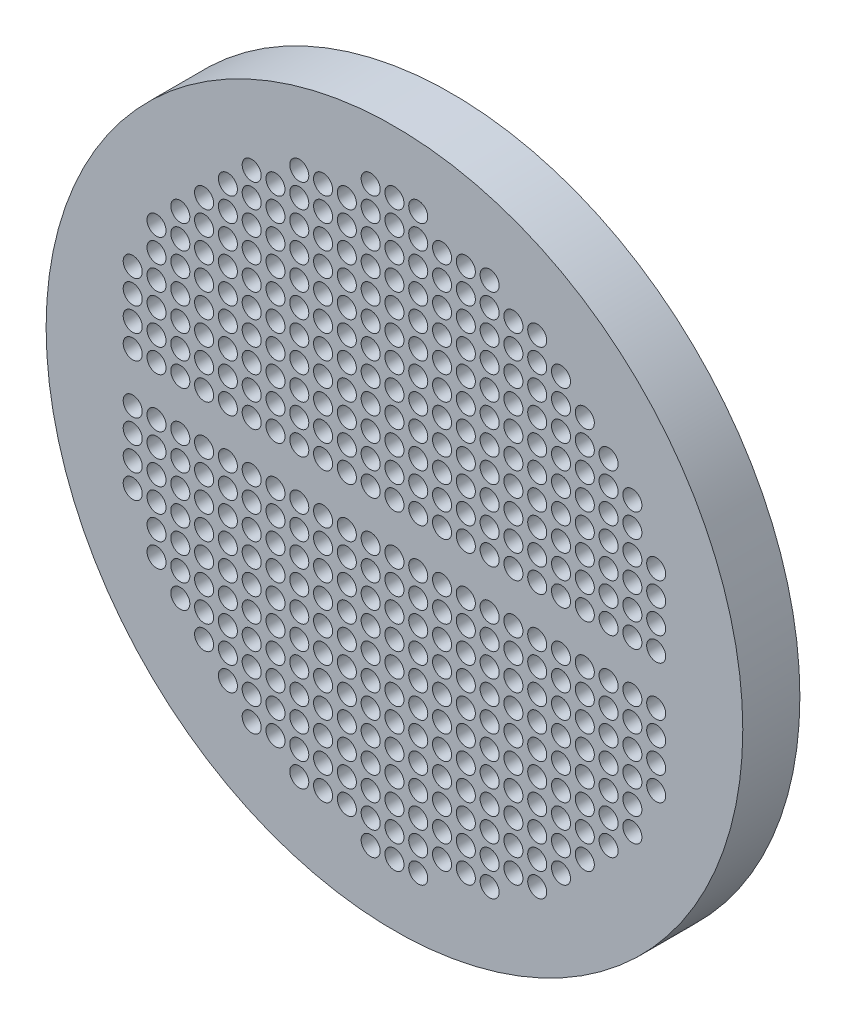
from build123d import *

# Parameters (mm, degrees)
SKETCH1_R           = 464.82
BOSS_EXTRUDE1_DEPTH = 76.2
SKETCH4_R           = 12.7
CUT_EXTRUDE1_DEPTH  = 76.2


with BuildPart() as part:
    # Sketch1 → Boss-Extrude1 (new body)
    with BuildSketch(Plane.XY):
        Circle(SKETCH1_R)
    extrude(amount=-BOSS_EXTRUDE1_DEPTH)

    # Sketch4 → Cut-Extrude1 (cut)
    with BuildSketch(Plane.XY):
        with Locations((0, 33.02)):
            Circle(SKETCH4_R)
        with Locations((-31.75, 33.02)):
            Circle(SKETCH4_R)
        with Locations((-63.5, 33.02)):
            Circle(SKETCH4_R)
        with Locations((-95.25, 33.02)):
            Circle(SKETCH4_R)
        with Locations((-127, 33.02)):
            Circle(SKETCH4_R)
        with Locations((-158.75, 33.02)):
            Circle(SKETCH4_R)
        with Locations((-190.5, 33.02)):
            Circle(SKETCH4_R)
        with Locations((-222.25, 33.02)):
            Circle(SKETCH4_R)
        with Locations((-254, 33.02)):
            Circle(SKETCH4_R)
        with Locations((-285.75, 33.02)):
            Circle(SKETCH4_R)
        with Locations((-317.5, 33.02)):
            Circle(SKETCH4_R)
        with Locations((-349.25, 33.02)):
            Circle(SKETCH4_R)
        with Locations((-31.75, 64.77)):
            Circle(SKETCH4_R)
        with Locations((-63.5, 64.77)):
            Circle(SKETCH4_R)
        with Locations((-95.25, 64.77)):
            Circle(SKETCH4_R)
        with Locations((-127, 64.77)):
            Circle(SKETCH4_R)
        with Locations((-158.75, 64.77)):
            Circle(SKETCH4_R)
        with Locations((-190.5, 64.77)):
            Circle(SKETCH4_R)
        with Locations((-222.25, 64.77)):
            Circle(SKETCH4_R)
        with Locations((-254, 64.77)):
            Circle(SKETCH4_R)
        with Locations((-285.75, 64.77)):
            Circle(SKETCH4_R)
        with Locations((-317.5, 64.77)):
            Circle(SKETCH4_R)
        with Locations((-349.25, 64.77)):
            Circle(SKETCH4_R)
        with Locations((-31.75, 96.52)):
            Circle(SKETCH4_R)
        with Locations((-63.5, 96.52)):
            Circle(SKETCH4_R)
        with Locations((-95.25, 96.52)):
            Circle(SKETCH4_R)
        with Locations((-127, 96.52)):
            Circle(SKETCH4_R)
        with Locations((-158.75, 96.52)):
            Circle(SKETCH4_R)
        with Locations((-190.5, 96.52)):
            Circle(SKETCH4_R)
        with Locations((-222.25, 96.52)):
            Circle(SKETCH4_R)
        with Locations((-254, 96.52)):
            Circle(SKETCH4_R)
        with Locations((-285.75, 96.52)):
            Circle(SKETCH4_R)
        with Locations((-317.5, 96.52)):
            Circle(SKETCH4_R)
        with Locations((-349.25, 96.52)):
            Circle(SKETCH4_R)
        with Locations((-31.75, 128.27)):
            Circle(SKETCH4_R)
        with Locations((-63.5, 128.27)):
            Circle(SKETCH4_R)
        with Locations((-95.25, 128.27)):
            Circle(SKETCH4_R)
        with Locations((-127, 128.27)):
            Circle(SKETCH4_R)
        with Locations((-158.75, 128.27)):
            Circle(SKETCH4_R)
        with Locations((-190.5, 128.27)):
            Circle(SKETCH4_R)
        with Locations((-222.25, 128.27)):
            Circle(SKETCH4_R)
        with Locations((-254, 128.27)):
            Circle(SKETCH4_R)
        with Locations((-285.75, 128.27)):
            Circle(SKETCH4_R)
        with Locations((-317.5, 128.27)):
            Circle(SKETCH4_R)
        with Locations((-349.25, 128.27)):
            Circle(SKETCH4_R)
        with Locations((-31.75, 160.02)):
            Circle(SKETCH4_R)
        with Locations((-63.5, 160.02)):
            Circle(SKETCH4_R)
        with Locations((-95.25, 160.02)):
            Circle(SKETCH4_R)
        with Locations((-127, 160.02)):
            Circle(SKETCH4_R)
        with Locations((-158.75, 160.02)):
            Circle(SKETCH4_R)
        with Locations((-190.5, 160.02)):
            Circle(SKETCH4_R)
        with Locations((-222.25, 160.02)):
            Circle(SKETCH4_R)
        with Locations((-254, 160.02)):
            Circle(SKETCH4_R)
        with Locations((-285.75, 160.02)):
            Circle(SKETCH4_R)
        with Locations((-317.5, 160.02)):
            Circle(SKETCH4_R)
        with Locations((-31.75, 191.77)):
            Circle(SKETCH4_R)
        with Locations((-63.5, 191.77)):
            Circle(SKETCH4_R)
        with Locations((-95.25, 191.77)):
            Circle(SKETCH4_R)
        with Locations((-127, 191.77)):
            Circle(SKETCH4_R)
        with Locations((-158.75, 191.77)):
            Circle(SKETCH4_R)
        with Locations((-190.5, 191.77)):
            Circle(SKETCH4_R)
        with Locations((-222.25, 191.77)):
            Circle(SKETCH4_R)
        with Locations((-254, 191.77)):
            Circle(SKETCH4_R)
        with Locations((-285.75, 191.77)):
            Circle(SKETCH4_R)
        with Locations((-317.5, 191.77)):
            Circle(SKETCH4_R)
        with Locations((-31.75, 223.52)):
            Circle(SKETCH4_R)
        with Locations((-63.5, 223.52)):
            Circle(SKETCH4_R)
        with Locations((-95.25, 223.52)):
            Circle(SKETCH4_R)
        with Locations((-127, 223.52)):
            Circle(SKETCH4_R)
        with Locations((-158.75, 223.52)):
            Circle(SKETCH4_R)
        with Locations((-190.5, 223.52)):
            Circle(SKETCH4_R)
        with Locations((-222.25, 223.52)):
            Circle(SKETCH4_R)
        with Locations((-254, 223.52)):
            Circle(SKETCH4_R)
        with Locations((-285.75, 223.52)):
            Circle(SKETCH4_R)
        with Locations((-31.75, 255.27)):
            Circle(SKETCH4_R)
        with Locations((-63.5, 255.27)):
            Circle(SKETCH4_R)
        with Locations((-95.25, 255.27)):
            Circle(SKETCH4_R)
        with Locations((-127, 255.27)):
            Circle(SKETCH4_R)
        with Locations((-158.75, 255.27)):
            Circle(SKETCH4_R)
        with Locations((-190.5, 255.27)):
            Circle(SKETCH4_R)
        with Locations((-222.25, 255.27)):
            Circle(SKETCH4_R)
        with Locations((-254, 255.27)):
            Circle(SKETCH4_R)
        with Locations((-31.75, 287.02)):
            Circle(SKETCH4_R)
        with Locations((-63.5, 287.02)):
            Circle(SKETCH4_R)
        with Locations((-95.25, 287.02)):
            Circle(SKETCH4_R)
        with Locations((-127, 287.02)):
            Circle(SKETCH4_R)
        with Locations((-158.75, 287.02)):
            Circle(SKETCH4_R)
        with Locations((-190.5, 287.02)):
            Circle(SKETCH4_R)
        with Locations((-222.25, 287.02)):
            Circle(SKETCH4_R)
        with Locations((-31.75, 318.77)):
            Circle(SKETCH4_R)
        with Locations((-63.5, 318.77)):
            Circle(SKETCH4_R)
        with Locations((-95.25, 318.77)):
            Circle(SKETCH4_R)
        with Locations((-127, 318.77)):
            Circle(SKETCH4_R)
        with Locations((-158.75, 318.77)):
            Circle(SKETCH4_R)
        with Locations((-190.5, 318.77)):
            Circle(SKETCH4_R)
        with Locations((-31.75, 350.52)):
            Circle(SKETCH4_R)
        with Locations((-63.5, 350.52)):
            Circle(SKETCH4_R)
        with Locations((-95.25, 350.52)):
            Circle(SKETCH4_R)
        with Locations((-127, 350.52)):
            Circle(SKETCH4_R)
        with Locations((-31.75, 382.27)):
            Circle(SKETCH4_R)
        with Locations((0, 64.77)):
            Circle(SKETCH4_R)
        with Locations((0, 96.52)):
            Circle(SKETCH4_R)
        with Locations((0, 128.27)):
            Circle(SKETCH4_R)
        with Locations((0, 160.02)):
            Circle(SKETCH4_R)
        with Locations((0, 191.77)):
            Circle(SKETCH4_R)
        with Locations((0, 223.52)):
            Circle(SKETCH4_R)
        with Locations((0, 255.27)):
            Circle(SKETCH4_R)
        with Locations((0, 287.02)):
            Circle(SKETCH4_R)
        with Locations((0, 318.77)):
            Circle(SKETCH4_R)
        with Locations((0, 350.52)):
            Circle(SKETCH4_R)
        with Locations((0, 382.27)):
            Circle(SKETCH4_R)
        with Locations((63.5, 350.52)):
            Circle(SKETCH4_R)
        with Locations((31.75, 350.52)):
            Circle(SKETCH4_R)
        with Locations((63.5, 318.77)):
            Circle(SKETCH4_R)
        with Locations((31.75, 318.77)):
            Circle(SKETCH4_R)
        with Locations((31.75, 287.02)):
            Circle(SKETCH4_R)
        with Locations((63.5, 255.27)):
            Circle(SKETCH4_R)
        with Locations((31.75, 255.27)):
            Circle(SKETCH4_R)
        with Locations((63.5, 223.52)):
            Circle(SKETCH4_R)
        with Locations((31.75, 223.52)):
            Circle(SKETCH4_R)
        with Locations((31.75, 191.77)):
            Circle(SKETCH4_R)
        with Locations((63.5, 160.02)):
            Circle(SKETCH4_R)
        with Locations((31.75, 160.02)):
            Circle(SKETCH4_R)
        with Locations((63.5, 128.27)):
            Circle(SKETCH4_R)
        with Locations((31.75, 128.27)):
            Circle(SKETCH4_R)
        with Locations((349.25, 96.52)):
            Circle(SKETCH4_R)
        with Locations((317.5, 96.52)):
            Circle(SKETCH4_R)
        with Locations((285.75, 96.52)):
            Circle(SKETCH4_R)
        with Locations((254, 96.52)):
            Circle(SKETCH4_R)
        with Locations((222.25, 96.52)):
            Circle(SKETCH4_R)
        with Locations((190.5, 96.52)):
            Circle(SKETCH4_R)
        with Locations((158.75, 96.52)):
            Circle(SKETCH4_R)
        with Locations((127, 96.52)):
            Circle(SKETCH4_R)
        with Locations((95.25, 96.52)):
            Circle(SKETCH4_R)
        with Locations((63.5, 96.52)):
            Circle(SKETCH4_R)
        with Locations((31.75, 96.52)):
            Circle(SKETCH4_R)
        with Locations((349.25, 64.77)):
            Circle(SKETCH4_R)
        with Locations((317.5, 64.77)):
            Circle(SKETCH4_R)
        with Locations((285.75, 64.77)):
            Circle(SKETCH4_R)
        with Locations((254, 64.77)):
            Circle(SKETCH4_R)
        with Locations((222.25, 64.77)):
            Circle(SKETCH4_R)
        with Locations((190.5, 64.77)):
            Circle(SKETCH4_R)
        with Locations((158.75, 64.77)):
            Circle(SKETCH4_R)
        with Locations((127, 64.77)):
            Circle(SKETCH4_R)
        with Locations((95.25, 64.77)):
            Circle(SKETCH4_R)
        with Locations((63.5, 64.77)):
            Circle(SKETCH4_R)
        with Locations((31.75, 64.77)):
            Circle(SKETCH4_R)
        with Locations((349.25, 33.02)):
            Circle(SKETCH4_R)
        with Locations((317.5, 33.02)):
            Circle(SKETCH4_R)
        with Locations((285.75, 33.02)):
            Circle(SKETCH4_R)
        with Locations((254, 33.02)):
            Circle(SKETCH4_R)
        with Locations((222.25, 33.02)):
            Circle(SKETCH4_R)
        with Locations((190.5, 33.02)):
            Circle(SKETCH4_R)
        with Locations((158.75, 33.02)):
            Circle(SKETCH4_R)
        with Locations((127, 33.02)):
            Circle(SKETCH4_R)
        with Locations((95.25, 33.02)):
            Circle(SKETCH4_R)
        with Locations((63.5, 33.02)):
            Circle(SKETCH4_R)
        with Locations((31.75, 33.02)):
            Circle(SKETCH4_R)
        with Locations((127, 350.52)):
            Circle(SKETCH4_R)
        with Locations((95.25, 350.52)):
            Circle(SKETCH4_R)
        with Locations((190.5, 318.77)):
            Circle(SKETCH4_R)
        with Locations((127, 318.77)):
            Circle(SKETCH4_R)
        with Locations((95.25, 318.77)):
            Circle(SKETCH4_R)
        with Locations((222.25, 287.02)):
            Circle(SKETCH4_R)
        with Locations((190.5, 287.02)):
            Circle(SKETCH4_R)
        with Locations((158.75, 287.02)):
            Circle(SKETCH4_R)
        with Locations((95.25, 287.02)):
            Circle(SKETCH4_R)
        with Locations((254, 255.27)):
            Circle(SKETCH4_R)
        with Locations((222.25, 255.27)):
            Circle(SKETCH4_R)
        with Locations((190.5, 255.27)):
            Circle(SKETCH4_R)
        with Locations((158.75, 255.27)):
            Circle(SKETCH4_R)
        with Locations((127, 255.27)):
            Circle(SKETCH4_R)
        with Locations((95.25, 255.27)):
            Circle(SKETCH4_R)
        with Locations((285.75, 223.52)):
            Circle(SKETCH4_R)
        with Locations((254, 223.52)):
            Circle(SKETCH4_R)
        with Locations((222.25, 223.52)):
            Circle(SKETCH4_R)
        with Locations((158.75, 223.52)):
            Circle(SKETCH4_R)
        with Locations((127, 223.52)):
            Circle(SKETCH4_R)
        with Locations((95.25, 223.52)):
            Circle(SKETCH4_R)
        with Locations((317.5, 191.77)):
            Circle(SKETCH4_R)
        with Locations((285.75, 191.77)):
            Circle(SKETCH4_R)
        with Locations((254, 191.77)):
            Circle(SKETCH4_R)
        with Locations((222.25, 191.77)):
            Circle(SKETCH4_R)
        with Locations((190.5, 191.77)):
            Circle(SKETCH4_R)
        with Locations((158.75, 191.77)):
            Circle(SKETCH4_R)
        with Locations((127, 191.77)):
            Circle(SKETCH4_R)
        with Locations((95.25, 191.77)):
            Circle(SKETCH4_R)
        with Locations((317.5, 160.02)):
            Circle(SKETCH4_R)
        with Locations((285.75, 160.02)):
            Circle(SKETCH4_R)
        with Locations((254, 160.02)):
            Circle(SKETCH4_R)
        with Locations((222.25, 160.02)):
            Circle(SKETCH4_R)
        with Locations((190.5, 160.02)):
            Circle(SKETCH4_R)
        with Locations((158.75, 160.02)):
            Circle(SKETCH4_R)
        with Locations((127, 160.02)):
            Circle(SKETCH4_R)
        with Locations((95.25, 160.02)):
            Circle(SKETCH4_R)
        with Locations((349.25, 128.27)):
            Circle(SKETCH4_R)
        with Locations((317.5, 128.27)):
            Circle(SKETCH4_R)
        with Locations((285.75, 128.27)):
            Circle(SKETCH4_R)
        with Locations((254, 128.27)):
            Circle(SKETCH4_R)
        with Locations((222.25, 128.27)):
            Circle(SKETCH4_R)
        with Locations((190.5, 128.27)):
            Circle(SKETCH4_R)
        with Locations((158.75, 128.27)):
            Circle(SKETCH4_R)
        with Locations((127, 128.27)):
            Circle(SKETCH4_R)
        with Locations((95.25, 128.27)):
            Circle(SKETCH4_R)
        with Locations((127, 287.02)):
            Circle(SKETCH4_R)
        with Locations((63.5, 287.02)):
            Circle(SKETCH4_R)
        with Locations((63.5, 191.77)):
            Circle(SKETCH4_R)
        with Locations((190.5, 223.52)):
            Circle(SKETCH4_R)
        with Locations((158.75, 318.77)):
            Circle(SKETCH4_R)
        with Locations((31.75, 382.27)):
            Circle(SKETCH4_R)
        with Locations((31.75, -382.27)):
            Circle(SKETCH4_R)
        with Locations((158.75, -318.77)):
            Circle(SKETCH4_R)
        with Locations((190.5, -223.52)):
            Circle(SKETCH4_R)
        with Locations((63.5, -191.77)):
            Circle(SKETCH4_R)
        with Locations((63.5, -287.02)):
            Circle(SKETCH4_R)
        with Locations((127, -287.02)):
            Circle(SKETCH4_R)
        with Locations((95.25, -128.27)):
            Circle(SKETCH4_R)
        with Locations((127, -128.27)):
            Circle(SKETCH4_R)
        with Locations((158.75, -128.27)):
            Circle(SKETCH4_R)
        with Locations((190.5, -128.27)):
            Circle(SKETCH4_R)
        with Locations((222.25, -128.27)):
            Circle(SKETCH4_R)
        with Locations((254, -128.27)):
            Circle(SKETCH4_R)
        with Locations((285.75, -128.27)):
            Circle(SKETCH4_R)
        with Locations((317.5, -128.27)):
            Circle(SKETCH4_R)
        with Locations((349.25, -128.27)):
            Circle(SKETCH4_R)
        with Locations((95.25, -160.02)):
            Circle(SKETCH4_R)
        with Locations((127, -160.02)):
            Circle(SKETCH4_R)
        with Locations((158.75, -160.02)):
            Circle(SKETCH4_R)
        with Locations((190.5, -160.02)):
            Circle(SKETCH4_R)
        with Locations((222.25, -160.02)):
            Circle(SKETCH4_R)
        with Locations((254, -160.02)):
            Circle(SKETCH4_R)
        with Locations((285.75, -160.02)):
            Circle(SKETCH4_R)
        with Locations((317.5, -160.02)):
            Circle(SKETCH4_R)
        with Locations((95.25, -191.77)):
            Circle(SKETCH4_R)
        with Locations((127, -191.77)):
            Circle(SKETCH4_R)
        with Locations((158.75, -191.77)):
            Circle(SKETCH4_R)
        with Locations((190.5, -191.77)):
            Circle(SKETCH4_R)
        with Locations((222.25, -191.77)):
            Circle(SKETCH4_R)
        with Locations((254, -191.77)):
            Circle(SKETCH4_R)
        with Locations((285.75, -191.77)):
            Circle(SKETCH4_R)
        with Locations((317.5, -191.77)):
            Circle(SKETCH4_R)
        with Locations((95.25, -223.52)):
            Circle(SKETCH4_R)
        with Locations((127, -223.52)):
            Circle(SKETCH4_R)
        with Locations((158.75, -223.52)):
            Circle(SKETCH4_R)
        with Locations((222.25, -223.52)):
            Circle(SKETCH4_R)
        with Locations((254, -223.52)):
            Circle(SKETCH4_R)
        with Locations((285.75, -223.52)):
            Circle(SKETCH4_R)
        with Locations((95.25, -255.27)):
            Circle(SKETCH4_R)
        with Locations((127, -255.27)):
            Circle(SKETCH4_R)
        with Locations((158.75, -255.27)):
            Circle(SKETCH4_R)
        with Locations((190.5, -255.27)):
            Circle(SKETCH4_R)
        with Locations((222.25, -255.27)):
            Circle(SKETCH4_R)
        with Locations((254, -255.27)):
            Circle(SKETCH4_R)
        with Locations((95.25, -287.02)):
            Circle(SKETCH4_R)
        with Locations((158.75, -287.02)):
            Circle(SKETCH4_R)
        with Locations((190.5, -287.02)):
            Circle(SKETCH4_R)
        with Locations((222.25, -287.02)):
            Circle(SKETCH4_R)
        with Locations((95.25, -318.77)):
            Circle(SKETCH4_R)
        with Locations((127, -318.77)):
            Circle(SKETCH4_R)
        with Locations((190.5, -318.77)):
            Circle(SKETCH4_R)
        with Locations((95.25, -350.52)):
            Circle(SKETCH4_R)
        with Locations((127, -350.52)):
            Circle(SKETCH4_R)
        with Locations((31.75, -33.02)):
            Circle(SKETCH4_R)
        with Locations((63.5, -33.02)):
            Circle(SKETCH4_R)
        with Locations((95.25, -33.02)):
            Circle(SKETCH4_R)
        with Locations((127, -33.02)):
            Circle(SKETCH4_R)
        with Locations((158.75, -33.02)):
            Circle(SKETCH4_R)
        with Locations((190.5, -33.02)):
            Circle(SKETCH4_R)
        with Locations((222.25, -33.02)):
            Circle(SKETCH4_R)
        with Locations((254, -33.02)):
            Circle(SKETCH4_R)
        with Locations((285.75, -33.02)):
            Circle(SKETCH4_R)
        with Locations((317.5, -33.02)):
            Circle(SKETCH4_R)
        with Locations((349.25, -33.02)):
            Circle(SKETCH4_R)
        with Locations((31.75, -64.77)):
            Circle(SKETCH4_R)
        with Locations((63.5, -64.77)):
            Circle(SKETCH4_R)
        with Locations((95.25, -64.77)):
            Circle(SKETCH4_R)
        with Locations((127, -64.77)):
            Circle(SKETCH4_R)
        with Locations((158.75, -64.77)):
            Circle(SKETCH4_R)
        with Locations((190.5, -64.77)):
            Circle(SKETCH4_R)
        with Locations((222.25, -64.77)):
            Circle(SKETCH4_R)
        with Locations((254, -64.77)):
            Circle(SKETCH4_R)
        with Locations((285.75, -64.77)):
            Circle(SKETCH4_R)
        with Locations((317.5, -64.77)):
            Circle(SKETCH4_R)
        with Locations((349.25, -64.77)):
            Circle(SKETCH4_R)
        with Locations((31.75, -96.52)):
            Circle(SKETCH4_R)
        with Locations((63.5, -96.52)):
            Circle(SKETCH4_R)
        with Locations((95.25, -96.52)):
            Circle(SKETCH4_R)
        with Locations((127, -96.52)):
            Circle(SKETCH4_R)
        with Locations((158.75, -96.52)):
            Circle(SKETCH4_R)
        with Locations((190.5, -96.52)):
            Circle(SKETCH4_R)
        with Locations((222.25, -96.52)):
            Circle(SKETCH4_R)
        with Locations((254, -96.52)):
            Circle(SKETCH4_R)
        with Locations((285.75, -96.52)):
            Circle(SKETCH4_R)
        with Locations((317.5, -96.52)):
            Circle(SKETCH4_R)
        with Locations((349.25, -96.52)):
            Circle(SKETCH4_R)
        with Locations((31.75, -128.27)):
            Circle(SKETCH4_R)
        with Locations((63.5, -128.27)):
            Circle(SKETCH4_R)
        with Locations((31.75, -160.02)):
            Circle(SKETCH4_R)
        with Locations((63.5, -160.02)):
            Circle(SKETCH4_R)
        with Locations((31.75, -191.77)):
            Circle(SKETCH4_R)
        with Locations((31.75, -223.52)):
            Circle(SKETCH4_R)
        with Locations((63.5, -223.52)):
            Circle(SKETCH4_R)
        with Locations((31.75, -255.27)):
            Circle(SKETCH4_R)
        with Locations((63.5, -255.27)):
            Circle(SKETCH4_R)
        with Locations((31.75, -287.02)):
            Circle(SKETCH4_R)
        with Locations((31.75, -318.77)):
            Circle(SKETCH4_R)
        with Locations((63.5, -318.77)):
            Circle(SKETCH4_R)
        with Locations((31.75, -350.52)):
            Circle(SKETCH4_R)
        with Locations((63.5, -350.52)):
            Circle(SKETCH4_R)
        with Locations((0, -382.27)):
            Circle(SKETCH4_R)
        with Locations((0, -350.52)):
            Circle(SKETCH4_R)
        with Locations((0, -318.77)):
            Circle(SKETCH4_R)
        with Locations((0, -287.02)):
            Circle(SKETCH4_R)
        with Locations((0, -255.27)):
            Circle(SKETCH4_R)
        with Locations((0, -223.52)):
            Circle(SKETCH4_R)
        with Locations((0, -191.77)):
            Circle(SKETCH4_R)
        with Locations((0, -160.02)):
            Circle(SKETCH4_R)
        with Locations((0, -128.27)):
            Circle(SKETCH4_R)
        with Locations((0, -96.52)):
            Circle(SKETCH4_R)
        with Locations((0, -64.77)):
            Circle(SKETCH4_R)
        with Locations((-31.75, -382.27)):
            Circle(SKETCH4_R)
        with Locations((-127, -350.52)):
            Circle(SKETCH4_R)
        with Locations((-95.25, -350.52)):
            Circle(SKETCH4_R)
        with Locations((-63.5, -350.52)):
            Circle(SKETCH4_R)
        with Locations((-31.75, -350.52)):
            Circle(SKETCH4_R)
        with Locations((-190.5, -318.77)):
            Circle(SKETCH4_R)
        with Locations((-158.75, -318.77)):
            Circle(SKETCH4_R)
        with Locations((-127, -318.77)):
            Circle(SKETCH4_R)
        with Locations((-95.25, -318.77)):
            Circle(SKETCH4_R)
        with Locations((-63.5, -318.77)):
            Circle(SKETCH4_R)
        with Locations((-31.75, -318.77)):
            Circle(SKETCH4_R)
        with Locations((-222.25, -287.02)):
            Circle(SKETCH4_R)
        with Locations((-190.5, -287.02)):
            Circle(SKETCH4_R)
        with Locations((-158.75, -287.02)):
            Circle(SKETCH4_R)
        with Locations((-127, -287.02)):
            Circle(SKETCH4_R)
        with Locations((-95.25, -287.02)):
            Circle(SKETCH4_R)
        with Locations((-63.5, -287.02)):
            Circle(SKETCH4_R)
        with Locations((-31.75, -287.02)):
            Circle(SKETCH4_R)
        with Locations((-254, -255.27)):
            Circle(SKETCH4_R)
        with Locations((-222.25, -255.27)):
            Circle(SKETCH4_R)
        with Locations((-190.5, -255.27)):
            Circle(SKETCH4_R)
        with Locations((-158.75, -255.27)):
            Circle(SKETCH4_R)
        with Locations((-127, -255.27)):
            Circle(SKETCH4_R)
        with Locations((-95.25, -255.27)):
            Circle(SKETCH4_R)
        with Locations((-63.5, -255.27)):
            Circle(SKETCH4_R)
        with Locations((-31.75, -255.27)):
            Circle(SKETCH4_R)
        with Locations((-285.75, -223.52)):
            Circle(SKETCH4_R)
        with Locations((-254, -223.52)):
            Circle(SKETCH4_R)
        with Locations((-222.25, -223.52)):
            Circle(SKETCH4_R)
        with Locations((-190.5, -223.52)):
            Circle(SKETCH4_R)
        with Locations((-158.75, -223.52)):
            Circle(SKETCH4_R)
        with Locations((-127, -223.52)):
            Circle(SKETCH4_R)
        with Locations((-95.25, -223.52)):
            Circle(SKETCH4_R)
        with Locations((-63.5, -223.52)):
            Circle(SKETCH4_R)
        with Locations((-31.75, -223.52)):
            Circle(SKETCH4_R)
        with Locations((-317.5, -191.77)):
            Circle(SKETCH4_R)
        with Locations((-285.75, -191.77)):
            Circle(SKETCH4_R)
        with Locations((-254, -191.77)):
            Circle(SKETCH4_R)
        with Locations((-222.25, -191.77)):
            Circle(SKETCH4_R)
        with Locations((-190.5, -191.77)):
            Circle(SKETCH4_R)
        with Locations((-158.75, -191.77)):
            Circle(SKETCH4_R)
        with Locations((-127, -191.77)):
            Circle(SKETCH4_R)
        with Locations((-95.25, -191.77)):
            Circle(SKETCH4_R)
        with Locations((-63.5, -191.77)):
            Circle(SKETCH4_R)
        with Locations((-31.75, -191.77)):
            Circle(SKETCH4_R)
        with Locations((-317.5, -160.02)):
            Circle(SKETCH4_R)
        with Locations((-285.75, -160.02)):
            Circle(SKETCH4_R)
        with Locations((-254, -160.02)):
            Circle(SKETCH4_R)
        with Locations((-222.25, -160.02)):
            Circle(SKETCH4_R)
        with Locations((-190.5, -160.02)):
            Circle(SKETCH4_R)
        with Locations((-158.75, -160.02)):
            Circle(SKETCH4_R)
        with Locations((-127, -160.02)):
            Circle(SKETCH4_R)
        with Locations((-95.25, -160.02)):
            Circle(SKETCH4_R)
        with Locations((-63.5, -160.02)):
            Circle(SKETCH4_R)
        with Locations((-31.75, -160.02)):
            Circle(SKETCH4_R)
        with Locations((-349.25, -128.27)):
            Circle(SKETCH4_R)
        with Locations((-317.5, -128.27)):
            Circle(SKETCH4_R)
        with Locations((-285.75, -128.27)):
            Circle(SKETCH4_R)
        with Locations((-254, -128.27)):
            Circle(SKETCH4_R)
        with Locations((-222.25, -128.27)):
            Circle(SKETCH4_R)
        with Locations((-190.5, -128.27)):
            Circle(SKETCH4_R)
        with Locations((-158.75, -128.27)):
            Circle(SKETCH4_R)
        with Locations((-127, -128.27)):
            Circle(SKETCH4_R)
        with Locations((-95.25, -128.27)):
            Circle(SKETCH4_R)
        with Locations((-63.5, -128.27)):
            Circle(SKETCH4_R)
        with Locations((-31.75, -128.27)):
            Circle(SKETCH4_R)
        with Locations((-349.25, -96.52)):
            Circle(SKETCH4_R)
        with Locations((-317.5, -96.52)):
            Circle(SKETCH4_R)
        with Locations((-285.75, -96.52)):
            Circle(SKETCH4_R)
        with Locations((-254, -96.52)):
            Circle(SKETCH4_R)
        with Locations((-222.25, -96.52)):
            Circle(SKETCH4_R)
        with Locations((-190.5, -96.52)):
            Circle(SKETCH4_R)
        with Locations((-158.75, -96.52)):
            Circle(SKETCH4_R)
        with Locations((-127, -96.52)):
            Circle(SKETCH4_R)
        with Locations((-95.25, -96.52)):
            Circle(SKETCH4_R)
        with Locations((-63.5, -96.52)):
            Circle(SKETCH4_R)
        with Locations((-31.75, -96.52)):
            Circle(SKETCH4_R)
        with Locations((-349.25, -64.77)):
            Circle(SKETCH4_R)
        with Locations((-317.5, -64.77)):
            Circle(SKETCH4_R)
        with Locations((-285.75, -64.77)):
            Circle(SKETCH4_R)
        with Locations((-254, -64.77)):
            Circle(SKETCH4_R)
        with Locations((-222.25, -64.77)):
            Circle(SKETCH4_R)
        with Locations((-190.5, -64.77)):
            Circle(SKETCH4_R)
        with Locations((-158.75, -64.77)):
            Circle(SKETCH4_R)
        with Locations((-127, -64.77)):
            Circle(SKETCH4_R)
        with Locations((-95.25, -64.77)):
            Circle(SKETCH4_R)
        with Locations((-63.5, -64.77)):
            Circle(SKETCH4_R)
        with Locations((-31.75, -64.77)):
            Circle(SKETCH4_R)
        with Locations((-349.25, -33.02)):
            Circle(SKETCH4_R)
        with Locations((-317.5, -33.02)):
            Circle(SKETCH4_R)
        with Locations((-285.75, -33.02)):
            Circle(SKETCH4_R)
        with Locations((-254, -33.02)):
            Circle(SKETCH4_R)
        with Locations((-222.25, -33.02)):
            Circle(SKETCH4_R)
        with Locations((-190.5, -33.02)):
            Circle(SKETCH4_R)
        with Locations((-158.75, -33.02)):
            Circle(SKETCH4_R)
        with Locations((-127, -33.02)):
            Circle(SKETCH4_R)
        with Locations((-95.25, -33.02)):
            Circle(SKETCH4_R)
        with Locations((-63.5, -33.02)):
            Circle(SKETCH4_R)
        with Locations((-31.75, -33.02)):
            Circle(SKETCH4_R)
        with Locations((0, -33.02)):
            Circle(SKETCH4_R)
    extrude(amount=-CUT_EXTRUDE1_DEPTH, mode=Mode.SUBTRACT)


solid = part.part
